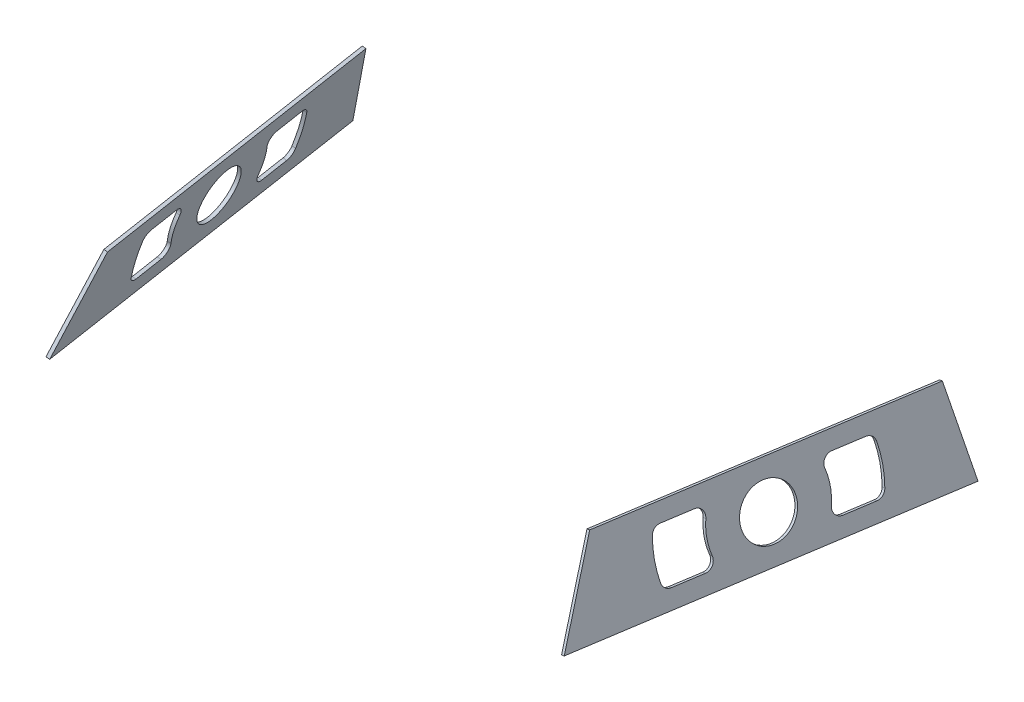
from build123d import *

# Parameters (mm, degrees)
BOSS_EXTRUDE1_START     = 12.7
BOSS_EXTRUDE1_DEPTH     = 2
CUT_EXTRUDE4_DEPTH      = 1828.912506822
CUT_EXTRUDE4_DEPTH_BACK = 1828.912506822
SKETCH3_R               = 15
CUT_EXTRUDE5_DEPTH      = 1828.838510921
CUT_EXTRUDE5_DEPTH_BACK = 1828.838510921


with BuildPart() as part:
    # Sketch1 → Boss-Extrude1 (new body)
    with BuildSketch(Plane(origin=(-580.593547235, 163.579619072, 89.411341221), x_dir=(0.14113228200830932, -0.039763385314259575, 0.9891918682255111), z_dir=(-0.9521234207356767, 0.2682564889244443, 0.1466269001122346)).offset(BOSS_EXTRUDE1_START)):
        Polygon((1424.317146299, 809.618947984), (1417.472842415, 759.287294526), (1634.898287862, 768.421889345), (1609.635846456, 817.404656942), align=None)
    extrude(amount=BOSS_EXTRUDE1_DEPTH)

    # Sketch3 → Cut-Extrude4 (cut, two sides: drawn at the far end of the back side and taken through both)
    with BuildSketch(Plane(origin=(-580.593547235, 163.579619072, 89.411341221), x_dir=(0.14113228200830932, -0.039763385314259575, 0.9891918682255111), z_dir=(-0.9521234207356767, 0.2682564889244443, 0.1466269001122346)).offset(-CUT_EXTRUDE4_DEPTH_BACK)):
        with Locations((1521.581030758, 788.683197199)):
            Circle(SKETCH3_R)
    extrude(amount=CUT_EXTRUDE4_DEPTH + CUT_EXTRUDE4_DEPTH_BACK, mode=Mode.SUBTRACT)

    # Sketch4 → Cut-Extrude5 (cut, two sides: drawn at the far end of the back side and taken through both)
    with BuildSketch(Plane(origin=(-594.589761519, 167.522989459, 91.566756653), x_dir=(0.14225067959029494, -0.035789246111831756, 0.9891834380027024), z_dir=(-0.9521234207356765, 0.26825648892444487, 0.14662690011223467)).offset(-CUT_EXTRUDE5_DEPTH_BACK)):
        with BuildLine():
            Line((1488.140213415, 796.015876837), (1470.211881292, 795.336797814))
            ThreePointArc((1470.211881292, 795.336797814), (1467.059934866, 794.060111484), (1465.453585695, 791.062723187))
            ThreePointArc((1465.453585695, 791.062723187), (1464.867144442, 780.123596568), (1466.279410008, 769.260175812))
            ThreePointArc((1466.279410008, 769.260175812), (1468.107897911, 766.392890293), (1471.347389723, 765.358295173))
            Line((1471.347389723, 765.358295173), (1489.275721846, 766.037374196))
            ThreePointArc((1489.275721846, 766.037374196), (1493.177328639, 768.158921011), (1493.851494345, 772.548567587))
            ThreePointArc((1493.851494345, 772.548567587), (1492.34743853, 781.164479296), (1493.195422807, 789.869480224))
            ThreePointArc((1493.195422807, 789.869480224), (1492.191128185, 794.195551047), (1488.140213415, 796.015876837))
        make_face()
        with BuildLine():
            Line((1560.372577603, 798.751852663), (1578.300909726, 799.430931686))
            ThreePointArc((1578.300909726, 799.430931686), (1581.540401538, 798.396336567), (1583.368889441, 795.529051048))
            ThreePointArc((1583.368889441, 795.529051048), (1584.781155007, 784.665630292), (1584.194713755, 773.726503672))
            ThreePointArc((1584.194713755, 773.726503672), (1582.588364584, 770.729115375), (1579.436418157, 769.452429045))
            Line((1579.436418157, 769.452429045), (1561.508086034, 768.773350022))
            ThreePointArc((1561.508086034, 768.773350022), (1557.457171264, 770.593675812), (1556.452876642, 774.919746636))
            ThreePointArc((1556.452876642, 774.919746636), (1557.300860919, 783.624747563), (1555.796805104, 792.240659273))
            ThreePointArc((1555.796805104, 792.240659273), (1556.47097081, 796.630305849), (1560.372577603, 798.751852663))
        make_face()
    extrude(amount=CUT_EXTRUDE5_DEPTH + CUT_EXTRUDE5_DEPTH_BACK, mode=Mode.SUBTRACT)


with BuildPart() as body_2:
    # Mirror2: mirrored copy
    add(part.part.mirror(Plane(origin=(0, 0, 0), x_dir=(0, 0, 1), z_dir=(1, 0, 0))))


solid = Compound([part.part, body_2.part])
